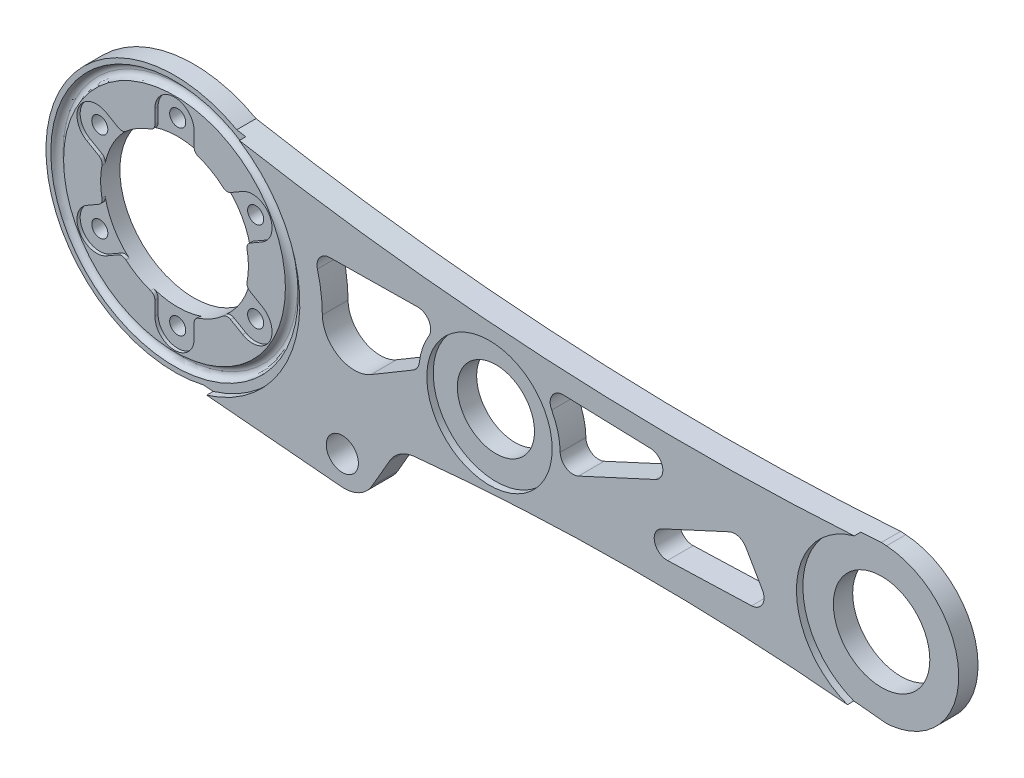
from build123d import *

# Parameters (mm, degrees)
SKETCH_1_R           = 11.5
EXTRUDE_1_DEPTH      = 3
SKETCH_2_R           = 6
CUT_EXTRUDE_1_DEPTH  = 10
SKETCH_3_R           = 7.5
CUT_EXTRUDE_2_DEPTH  = 10
SKETCH_5_R           = 1.25
CUT_EXTRUDE_4_DEPTH  = 10
SKETCH_9_W           = 9.785413343
SKETCH_9_H           = 10.582240284
EXTRUDE_4_DEPTH      = 3
EXTRUDE_6_DEPTH      = 3
SKETCH_13_R          = 400
CUT_EXTRUDE_6_DEPTH  = 10
EXTRUDE_7_DEPTH      = 3
SKETCH_15_R          = 2.5
CUT_EXTRUDE_7_DEPTH  = 10
EXTRUDE_START        = 1
SKETCH_19_R          = 9.75
SKETCH_19_R_2        = 2.5
EXTRUDE_8_DEPTH      = 1
FILLET_1_R           = 5
CUT_EXTRUDE_8_DEPTH  = 10
FILLET_2_R           = 2
FILLET_3_DEPTH       = 4
CUT_EXTRUDE_9_DEPTH  = 0.5
FILLET_5_R           = 1
SKETCH_21_R          = 20
SKETCH_21_R_2        = 17.05
EXTRUDE_9_DEPTH      = 3
EXTRUDE_START_2      = 0.1
SKETCH_23_R          = 20
SKETCH_23_R_2        = 17.05
EXTRUDE_10_DEPTH     = 0.1
SKETCH_22_R          = 19.25
SKETCH_22_R_2        = 17.25
CUT_EXTRUDE_14_DEPTH = 1
FILLET_7_R           = 1
SKETCH_24_R          = 20
CUT_EXTRUDE_15_DEPTH = 0.1


with BuildPart() as part:
    # 草图1 → 凸台-拉伸1 (new body)
    with BuildSketch(Plane.XY):
        with BuildLine():
            Line((1.209090909, 18.961489899), (110.763636364, 11.975677831))
            ThreePointArc((110.763636364, 11.975677831), (122, 0), (110.763636364, -11.975677831))
            Line((110.763636364, -11.975677831), (1.209090909, -18.961489899))
            ThreePointArc((1.209090909, -18.961489899), (-19, 0), (1.209090909, 18.961489899))
        make_face()
        Circle(SKETCH_1_R, mode=Mode.SUBTRACT)
    extrude(amount=EXTRUDE_1_DEPTH)

    # 草图2 → 切除-拉伸1 (cut)
    with BuildSketch(Plane(origin=(0, 0, 0), x_dir=(-1, 0, 0), z_dir=(0, 0, -1))):
        with Locations((-50, 0)):
            Circle(SKETCH_2_R)
    extrude(amount=-CUT_EXTRUDE_1_DEPTH, mode=Mode.SUBTRACT)

    # 草图3 → 切除-拉伸2 (cut)
    with BuildSketch(Plane(origin=(0, 0, 0), x_dir=(-1, 0, 0), z_dir=(0, 0, -1))):
        with Locations((-110, 0)):
            Circle(SKETCH_3_R)
    extrude(amount=-CUT_EXTRUDE_2_DEPTH, mode=Mode.SUBTRACT)

    # 草图5 → 切除-拉伸4 (cut)
    with BuildSketch(Plane(origin=(0, 0, 0), x_dir=(-1, 0, 0), z_dir=(0, 0, -1))):
        with Locations((0, 14)):
            Circle(SKETCH_5_R)
        with Locations((12.124355653, 7)):
            Circle(SKETCH_5_R)
        with Locations((12.124355653, -7)):
            Circle(SKETCH_5_R)
        with Locations((0, -14)):
            Circle(SKETCH_5_R)
        with Locations((-12.124355653, -7)):
            Circle(SKETCH_5_R)
        with Locations((-12.124355653, 7)):
            Circle(SKETCH_5_R)
    extrude(amount=-CUT_EXTRUDE_4_DEPTH, mode=Mode.SUBTRACT)

    # 草图9 → 凸台-拉伸4 (add, through all)
    with BuildSketch(Plane.XY.offset(3)):
        with Locations((26.618118247, 0)):
            Rectangle(SKETCH_9_W, SKETCH_9_H)
    extrude(amount=-EXTRUDE_4_DEPTH)

    # 草图12 → 凸台-拉伸6 (add)
    with BuildSketch(Plane.XY.offset(3)):
        Polygon((28.745410775, -6.403803536), (34.060824307, -16.874768539), (25.628100583, -16.874768539), (24.509066155, -9.241355121), align=None)
    extrude(amount=-EXTRUDE_6_DEPTH)

    # 草图13 → 切除-拉伸6 (cut)
    with BuildSketch(Plane.XY.offset(3)):
        with Locations((81.440909091, -411.008975968)):
            Circle(SKETCH_13_R)
        with BuildLine():
            Line((35.763636364, 11.975677831), (32.896967938, 16.940893192))
            Line((32.896967938, 16.940893192), (110.763636364, 11.975677831))
            ThreePointArc((110.763636364, 11.975677831), (73.263636364, 9.960950508), (35.763636364, 11.975677831))
        make_face()
    extrude(amount=-CUT_EXTRUDE_6_DEPTH, mode=Mode.SUBTRACT)

    # 草图16 → 凸台-拉伸7 (add)
    with BuildSketch(Plane.XY.offset(3)):
        Polygon((32.896967938, 16.940893192), (30.130621057, 21.732346541), (-1.669949201, 18.926470079), align=None)
    extrude(amount=-EXTRUDE_7_DEPTH)

    # 草图15 → 切除-拉伸7 (cut)
    with BuildSketch(Plane.XY.offset(3)):
        with Locations((27.103382326, 16.975677831)):
            Circle(SKETCH_15_R)
    extrude(amount=-CUT_EXTRUDE_7_DEPTH, mode=Mode.SUBTRACT)

    # 草图19 → 凸台-拉伸8 (add)
    with BuildSketch(Plane.XY.offset(3).offset(EXTRUDE_START)):
        with BuildLine():
            ThreePointArc((105.688354296, 11.466133233), (70.713238171, 9.970242818), (35.763636364, 11.975677831))
            Line((35.763636364, 11.975677831), (30.130621057, 21.732346541))
            Line((30.130621057, 21.732346541), (5.997664044, 19.603010637))
            ThreePointArc((5.997664044, 19.603010637), (20.307458553, 2.803056747), (11.083860146, -17.245232508))
            ThreePointArc((11.083860146, -17.245232508), (58.752317078, -11.652959621), (106.747426676, -11.810303416))
            ThreePointArc((106.747426676, -11.810303416), (97.762660496, -0.556796062), (105.688354296, 11.466133233))
        make_face()
        with Locations((50, 0)):
            Circle(SKETCH_19_R, mode=Mode.SUBTRACT)
        with Locations((27.103382326, 16.975677831)):
            Circle(SKETCH_19_R_2, mode=Mode.SUBTRACT)
    extrude(amount=-EXTRUDE_8_DEPTH)

    # 圆角1
    fillet_1_edges = [part.edges().sort_by_distance(p)[0] for p in [
        (35.763636364, 11.975677831, 2),
        (30.130621057, 21.732346541, 2),
        (110.763636364, 11.975677831, 1.5),
    ]]
    fillet(fillet_1_edges, radius=FILLET_1_R)

    # 草图4 → 切除-拉伸8 (cut)
    with BuildSketch(Plane(origin=(0, 0, 0), x_dir=(-1, 0, 0), z_dir=(0, 0, -1))):
        with BuildLine():
            Line((-22.718337944, 7.738030826), (-25.489112126, 7.658153323))
            Line((-25.489112126, 7.658153323), (-39.006073297, -0.365480019))
            ThreePointArc((-39.006073297, -0.365480019), (-40.223576833, -5.041978785), (-43.327845655, -8.745419166))
            Line((-43.327845655, -8.745419166), (-22.452972771, -8.477264519))
            ThreePointArc((-22.452972771, -8.477264519), (-23.996786842, -0.392710175), (-22.718337944, 7.738030826))
        make_face()
        with BuildLine():
            Line((-83.49595781, -7.485104525), (-57.207283211, -8.309937949))
            ThreePointArc((-57.207283211, -8.309937949), (-60.555711126, -3.094666805), (-60.553265828, 3.102995386))
            Line((-60.553265828, 3.102995386), (-83.49595781, -7.485104525))
        make_face()
        Polygon((-88.972134801, -3.404237943), (-67.80208643, 6.365783266), (-94.111121995, 5.483718321), align=None)
    extrude(amount=-CUT_EXTRUDE_8_DEPTH, mode=Mode.SUBTRACT)

    # 圆角2
    # the kernel refuses this fillet: 2 mm, written as the material it adds along each edge
    with BuildSketch(Plane(origin=(22.718337944, 7.738030826, 0), x_dir=(0.9995847151360328, -0.028816614416278277, 0), z_dir=(0, 0, 1))) as fillet_2_piece_1:
        with BuildLine():
            CenterArc((2.716749156, -2), FILLET_2_R, 90, 104.226121897)
            ThreePointArc((0.778082336, -2.491498686), (0.422937237, -1.235163774), (0, 0))
            Line((0, 0), (2.716749156, 0))
        make_face()
    extrude(amount=4)
    with BuildSketch(Plane(origin=(25.489112126, 7.658153323, 0), x_dir=(-0.9995847151360342, 0.028816614416228722, 0), z_dir=(0, 0, 1))) as fillet_2_piece_2:
        with BuildLine():
            CenterArc((FILLET_2_R * 0.259008280186, FILLET_2_R), FILLET_2_R, 240.958040197, 29.041959803)
            Line((-FILLET_2_R * 0.226441726119, FILLET_2_R * 0.12573557125), (0, 0))
            Line((0, 0), (FILLET_2_R * 0.259008280186, 0))
        make_face()
    extrude(amount=4)
    with BuildSketch(Plane(origin=(57.207283211, -8.309937949, 0), x_dir=(0.9995081364804766, 0.031360566151216684, 0), z_dir=(0, 0, 1))) as fillet_2_piece_3:
        with BuildLine():
            CenterArc((4.296733051, 2), FILLET_2_R, 149.837648672, 120.162351328)
            ThreePointArc((2.567522758, 3.004903858), (1.419830152, 1.386188751), (0, 0))
            Line((0, 0), (4.296733051, 0))
        make_face()
    extrude(amount=4)
    with BuildSketch(Plane(origin=(60.553265828, 3.102995386, 0), x_dir=(0.907971955307365, -0.4190309396396886, 0), z_dir=(0, 0, 1))) as fillet_2_piece_4:
        with BuildLine():
            CenterArc((3.615526985, -2), FILLET_2_R, 90, 113.768639436)
            ThreePointArc((1.785166166, -2.806088874), (0.999247071, -1.335187377), (0, 0))
            Line((0, 0), (3.615526985, 0))
        make_face()
    extrude(amount=4)
    with BuildSketch(Plane(origin=(83.49595781, -7.485104525, 0), x_dir=(-0.9079719553073375, 0.41903093963974836, 0), z_dir=(0, 0, 1))) as fillet_2_piece_5:
        with BuildLine():
            CenterArc((FILLET_2_R * 4.23516000471, FILLET_2_R), FILLET_2_R, 116.570544508, 153.429455492)
            Line((FILLET_2_R * 3.78786065654, FILLET_2_R * 1.89438430952), (0, 0))
            Line((0, 0), (FILLET_2_R * 4.23516000471, 0))
        make_face()
    extrude(amount=4)
    with BuildSketch(Plane(origin=(88.972134801, -3.404237943, 0), x_dir=(-0.9079719553073382, 0.41903093963974675, 0), z_dir=(0, 0, 1))) as fillet_2_piece_6:
        with BuildLine():
            CenterArc((FILLET_2_R * 0.912118784285, -FILLET_2_R), FILLET_2_R, 90, 84.737061388)
            Line((-FILLET_2_R * 0.0836654548784, -FILLET_2_R * 0.908273509635), (0, 0))
            Line((0, 0), (FILLET_2_R * 0.912118784285, 0))
        make_face()
    extrude(amount=4)
    with BuildSketch(Plane(origin=(94.111121995, 5.483718321, 0), x_dir=(-0.9994384410783521, 0.03350824517747174, 0), z_dir=(0, 0, 1))) as fillet_2_piece_7:
        with BuildLine():
            CenterArc((FILLET_2_R * 1.66810604239, FILLET_2_R), FILLET_2_R, 151.883880104, 118.116119896)
            Line((FILLET_2_R * 0.786111728241, FILLET_2_R * 1.47126004478), (0, 0))
            Line((0, 0), (FILLET_2_R * 1.66810604239, 0))
        make_face()
    extrude(amount=4)
    with BuildSketch(Plane(origin=(67.80208643, 6.365783266, 0), x_dir=(0.9079719553073374, -0.41903093963974836, 0), z_dir=(0, 0, 1))) as fillet_2_piece_8:
        with BuildLine():
            CenterArc((FILLET_2_R * 4.94759562481, FILLET_2_R), FILLET_2_R, 112.853181284, 157.146818716)
            Line((FILLET_2_R * 4.55922454262, FILLET_2_R * 1.92150306702), (0, 0))
            Line((0, 0), (FILLET_2_R * 4.94759562481, 0))
        make_face()
    extrude(amount=4)
    with BuildSketch(Plane(origin=(39.006073297, -0.365480019, 0), x_dir=(-0.8599123343159623, 0.5104417472065474, 0), z_dir=(0, 0, 1))) as fillet_2_piece_9:
        with BuildLine():
            CenterArc((1.037008755, 2), FILLET_2_R, 217.567480166, 52.432519834)
            ThreePointArc((-0.548262886, 0.780609241), (-0.265665753, 0.39625052), (0, 0))
            Line((0, 0), (1.037008755, 0))
        make_face()
    extrude(amount=4)
    with BuildSketch(Plane(origin=(22.452972771, -8.477264519, 0), x_dir=(0.9999175027948216, -0.01284475007806766, 0), z_dir=(0, 0, 1))) as fillet_2_piece_10:
        with BuildLine():
            CenterArc((2.692845423, 2), FILLET_2_R, 166.231102907, 103.768897093)
            ThreePointArc((0.750318174, 2.476012488), (0.408547652, 1.227888344), (0, 0))
            Line((0, 0), (2.692845423, 0))
        make_face()
    extrude(amount=4)
    with BuildSketch(Plane(origin=(43.327845655, -8.745419166, 0), x_dir=(-0.6666566833763927, 0.7453649217058637, 0), z_dir=(0, 0, 1))) as fillet_2_piece_11:
        with BuildLine():
            CenterArc((4.517437931, 1.964251261), FILLET_2_R, 137.454482312, 121.696210167)
            Line((3.043957146, 3.316602686), (0, 0))
            ThreePointArc((0, 0), (2.070492385, 0.196618063), (4.14098477, 0))
        make_face()
    extrude(amount=4)

    # 圆角3: read off the stored shape, not the designer's step
    # 圆角3 outline → 圆角3 (add)
    with BuildSketch(Plane.XY):
        with BuildLine():
            ThreePointArc((23.424300597, 5.225145123), (23.866306721, 2.529704233), (23.999179079, -0.198503227))
            ThreePointArc((23.999179079, -0.198503227), (26.543240849, 4.115507296), (31.55121679, 4.059703606))
            Line((31.55121679, 4.059703606), (25.934560956, 7.393736045))
            ThreePointArc((25.934560956, 7.393736045), (25.581112537, 7.559257609), (25.202247662, 7.652983694))
            ThreePointArc((25.202247662, 7.652983694), (23.762733827, 6.842234342), (23.424300597, 5.225145123))
        make_face()
    extrude(amount=FILLET_3_DEPTH)

    # 草图20 → 切除-拉伸9 (cut)
    with BuildSketch(Plane.XY.offset(3)):
        with BuildLine():
            Line((9.0877376, 1.724971107), (13.649355653, 4.358622518))
            ThreePointArc((13.649355653, 4.358622518), (14.765733135, 8.525), (10.599355653, 9.641377482))
            Line((10.599355653, 9.641377482), (6.0377376, 7.00772607))
            ThreePointArc((6.0377376, 7.00772607), (8.010734985, 4.625), (9.0877376, 1.724971107))
        make_face()
        with BuildLine():
            Line((6.0377376, -7.00772607), (10.599355653, -9.641377482))
            ThreePointArc((10.599355653, -9.641377482), (14.765733135, -8.525), (13.649355653, -4.358622518))
            Line((13.649355653, -4.358622518), (9.0877376, -1.724971107))
            ThreePointArc((9.0877376, -1.724971107), (8.010734985, -4.625), (6.0377376, -7.00772607))
        make_face()
        with BuildLine():
            Line((-3.05, -8.732697178), (-3.05, -14))
            ThreePointArc((-3.05, -14), (0, -17.05), (3.05, -14))
            Line((3.05, -14), (3.05, -8.732697178))
            ThreePointArc((3.05, -8.732697178), (0, -9.25), (-3.05, -8.732697178))
        make_face()
        with BuildLine():
            Line((-9.0877376, -1.724971107), (-13.649355653, -4.358622518))
            ThreePointArc((-13.649355653, -4.358622518), (-14.765733135, -8.525), (-10.599355653, -9.641377482))
            Line((-10.599355653, -9.641377482), (-6.0377376, -7.00772607))
            ThreePointArc((-6.0377376, -7.00772607), (-8.010734985, -4.625), (-9.0877376, -1.724971107))
        make_face()
        with BuildLine():
            Line((-6.0377376, 7.00772607), (-10.599355653, 9.641377482))
            ThreePointArc((-10.599355653, 9.641377482), (-14.765733135, 8.525), (-13.649355653, 4.358622518))
            Line((-13.649355653, 4.358622518), (-9.0877376, 1.724971107))
            ThreePointArc((-9.0877376, 1.724971107), (-8.010734985, 4.625), (-6.0377376, 7.00772607))
        make_face()
        with BuildLine():
            Line((3.05, 8.732697178), (3.05, 14))
            ThreePointArc((3.05, 14), (0, 17.05), (-3.05, 14))
            Line((-3.05, 14), (-3.05, 8.732697178))
            ThreePointArc((-3.05, 8.732697178), (0, 9.25), (3.05, 8.732697178))
        make_face()
    extrude(amount=-CUT_EXTRUDE_9_DEPTH, mode=Mode.SUBTRACT)

    # 圆角5
    fillet_5_edges = [part.edges().sort_by_distance(p)[0] for p in [
        (8.077636357, 8.185462167, 2.75),
        (11.127636357, 2.902707204, 2.75),
        (-3.05, 11.088169371, 2.75),
        (3.05, 11.088169371, 2.75),
        (-11.127636357, 2.902707204, 2.75),
        (-8.077636357, 8.185462167, 2.75),
        (-8.077636357, -8.185462167, 2.75),
        (-11.127636357, -2.902707204, 2.75),
        (3.05, -11.088169371, 2.75),
        (-3.05, -11.088169371, 2.75),
        (11.127636357, -2.902707204, 2.75),
        (8.077636357, -8.185462167, 2.75),
    ]]
    fillet(fillet_5_edges, radius=FILLET_5_R)

    # 草图21 → 凸台-拉伸9 (add)
    with BuildSketch(Plane.XY.offset(3)):
        Circle(SKETCH_21_R)
        Circle(SKETCH_21_R_2, mode=Mode.SUBTRACT)
    extrude(amount=-EXTRUDE_9_DEPTH)

    # 草图23 → 凸台-拉伸10 (add)
    with BuildSketch(Plane.XY.offset(3).offset(EXTRUDE_START_2)):
        Circle(SKETCH_23_R)
        with Locations(Location((0, 0, 0), (0, 0, 150))):
            Circle(SKETCH_23_R_2, mode=Mode.SUBTRACT)
    extrude(amount=-EXTRUDE_10_DEPTH)

    # 草图22 → 切除-拉伸14 (cut)
    with BuildSketch(Plane(origin=(0, 0, 3.1), x_dir=(-1, 0, 0), z_dir=(0, 0, -1))):
        Circle(SKETCH_22_R)
        Circle(SKETCH_22_R_2, mode=Mode.SUBTRACT)
    extrude(amount=CUT_EXTRUDE_14_DEPTH, mode=Mode.SUBTRACT)

    # 圆角7
    fillet_7_edges = [part.edges().sort_by_distance(p)[0] for p in [
        (19.25, 0, 2.1),
        (17.25, 0, 2.1),
    ]]
    fillet(fillet_7_edges, radius=FILLET_7_R - 0.0001)  # a hair under: the kernel refuses the full size

    # 草图24 → 切除-拉伸15 (cut)
    with BuildSketch(Plane.XY.offset(3.1)):
        Circle(SKETCH_24_R)
    extrude(amount=-CUT_EXTRUDE_15_DEPTH, mode=Mode.SUBTRACT)


with BuildPart() as body_2:
    # 镜向4: mirrored copy
    add(part.part.mirror(Plane.ZX.offset(-44.5)))


solid = body_2.part
